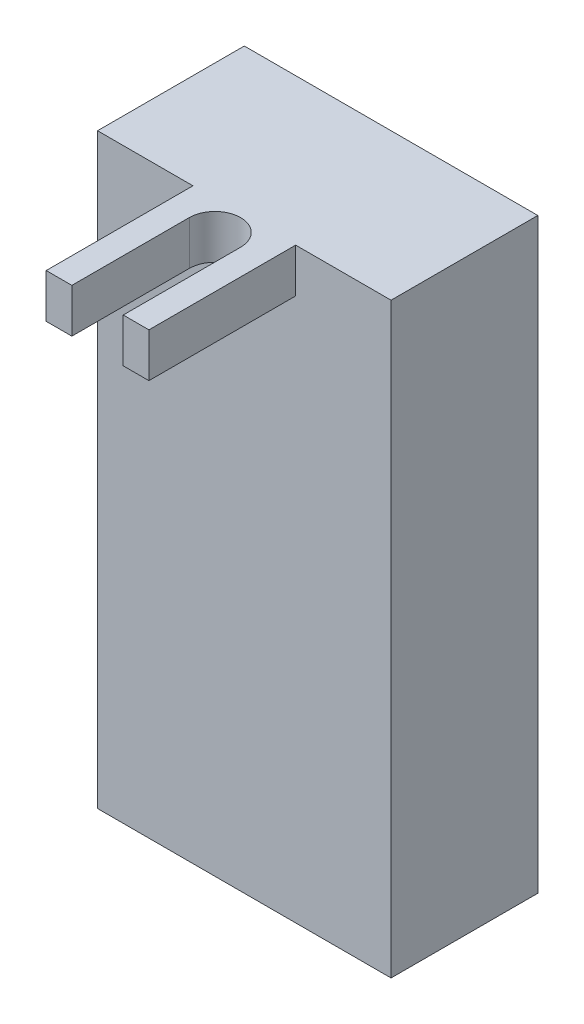
from build123d import *

# Parameters (mm, degrees)
SKETCH1_W           = 20
SKETCH1_H           = 40
BOSS_EXTRUDE1_DEPTH = 10
SKETCH2_W           = 7
SKETCH2_H           = 3
BOSS_EXTRUDE2_DEPTH = 10
CUT_EXTRUDE1_DEPTH  = 10


with BuildPart() as part:
    # Sketch1 → Boss-Extrude1 (new body)
    with BuildSketch(Plane.XY):
        with Locations((-10, 20)):
            Rectangle(SKETCH1_W, SKETCH1_H)
    extrude(amount=BOSS_EXTRUDE1_DEPTH)

    # Sketch2 → Boss-Extrude2 (add)
    with BuildSketch(Plane.XY.offset(10)):
        with Locations((-10, 38.5)):
            Rectangle(SKETCH2_W, SKETCH2_H)
    extrude(amount=BOSS_EXTRUDE2_DEPTH)

    # Sketch3 → Cut-Extrude1 (cut)
    with BuildSketch(Plane(origin=(0, 40, 0), x_dir=(1, 0, 0), z_dir=(0, 1, 0))):
        with BuildLine():
            Line((-11.75, -20), (-11.75, -12))
            ThreePointArc((-11.75, -12), (-10, -10.25), (-8.25, -12))
            Line((-8.25, -12), (-8.25, -20))
            ThreePointArc((-8.25, -20), (-10, -21.75), (-11.75, -20))
        make_face()
    extrude(amount=-CUT_EXTRUDE1_DEPTH, mode=Mode.SUBTRACT)


solid = part.part
